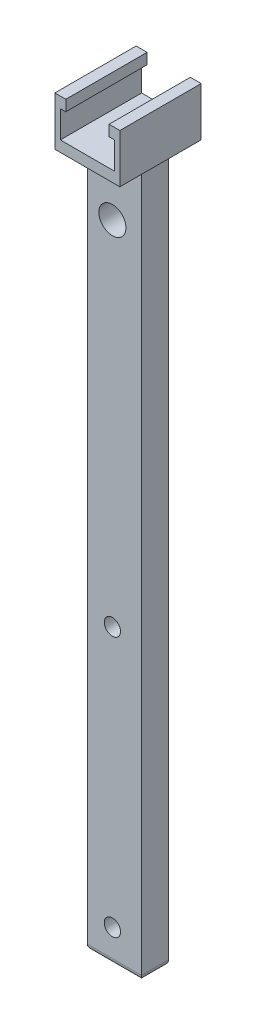
from build123d import *

# Parameters (mm, degrees)
BOSS_EXTRUDE1_DEPTH = 15
SKETCH2_W           = 10
SKETCH2_H           = 5
BOSS_EXTRUDE2_DEPTH = 130
FILLET3_R           = 1
FILLET4_R           = 1
FILLET5_R           = 1
FILLET6_R           = 1
CUT_EXTRUDE1_REACH  = 132.54
SKETCH3_R           = 2.5
SKETCH3_R_2         = 1.5


with BuildPart() as part:
    # Sketch1 → Boss-Extrude1 (new body)
    with BuildSketch(Plane.XY):
        Polygon((-5.618855965, 9), (-5.618855965, 0), (6.381144035, 0), (6.381144035, 9), (4.381144035, 9), (4.381144035, 7), (5.399108107, 7), (5.399108107, 2), (-4.600891893, 2), (-4.600891893, 7), (-3.600891893, 7), (-3.600891893, 9), align=None)
    extrude(amount=BOSS_EXTRUDE1_DEPTH)

    # Sketch2 → Boss-Extrude2 (add)
    with BuildSketch(Plane.XZ):
        with Locations((0.381144035, 7.5)):
            Rectangle(SKETCH2_W, SKETCH2_H)
    extrude(amount=BOSS_EXTRUDE2_DEPTH)

    # Fillet3
    fillet3_edges = [part.edges().sort_by_distance(p)[0] for p in [
        (0.381144035, 0, 10),
        (-4.618855965, 0, 7.5),
    ]]
    fillet(fillet3_edges, radius=FILLET3_R - 0.0001)  # a hair under: the kernel refuses the full size

    # Fillet4
    fillet4_edges = [part.edges().sort_by_distance(p)[0] for p in [
        (-0.118805965, 0, 5),
    ]]
    fillet(fillet4_edges, radius=FILLET4_R - 0.0001)  # a hair under: the kernel refuses the full size

    # Fillet5
    fillet5_edges = [part.edges().sort_by_distance(p)[0] for p in [
        (5.381144035, 0, 7.5),
    ]]
    fillet(fillet5_edges, radius=FILLET5_R - 0.0001)  # a hair under: the kernel refuses the full size

    # Fillet6
    fillet6_edges = [part.edges().sort_by_distance(p)[0] for p in [
        (-4.618855965, -130, 7.5),
        (0.381144035, -130, 5),
        (0.381144035, -130, 10),
        (5.381144035, -130, 7.5),
    ]]
    fillet(fillet6_edges, radius=FILLET6_R)

    # Sketch3 → Cut-Extrude1 (cut, up to next)
    with BuildSketch(Plane(origin=(0, 0, 5), x_dir=(-1, 0, 0), z_dir=(0, 0, -1)), mode=Mode.PRIVATE) as cut_extrude1_sk1:
        with Locations((0, -11)):
            Circle(SKETCH3_R)
    cut_extrude1_tool1 = extrude(cut_extrude1_sk1.sketch, amount=-CUT_EXTRUDE1_REACH, mode=Mode.PRIVATE) & part.part
    # Sketch3 → Cut-Extrude1 (cut, up to next)
    with BuildSketch(Plane(origin=(0, 0, 5), x_dir=(-1, 0, 0), z_dir=(0, 0, -1)), mode=Mode.PRIVATE) as cut_extrude1_sk2:
        with Locations((0, -124)):
            Circle(SKETCH3_R_2)
    cut_extrude1_tool2 = extrude(cut_extrude1_sk2.sketch, amount=-CUT_EXTRUDE1_REACH, mode=Mode.PRIVATE) & part.part
    # Sketch3 → Cut-Extrude1 (cut, up to next)
    with BuildSketch(Plane(origin=(0, 0, 5), x_dir=(-1, 0, 0), z_dir=(0, 0, -1)), mode=Mode.PRIVATE) as cut_extrude1_sk3:
        with Locations((0, -76)):
            Circle(SKETCH3_R_2)
    cut_extrude1_tool3 = extrude(cut_extrude1_sk3.sketch, amount=-CUT_EXTRUDE1_REACH, mode=Mode.PRIVATE) & part.part
    add(cut_extrude1_tool1.solids().sort_by_distance((0, -11, 5))[0], mode=Mode.SUBTRACT)
    add(cut_extrude1_tool2.solids().sort_by_distance((0, -124, 5))[0], mode=Mode.SUBTRACT)
    add(cut_extrude1_tool3.solids().sort_by_distance((0, -76, 5))[0], mode=Mode.SUBTRACT)


solid = part.part
